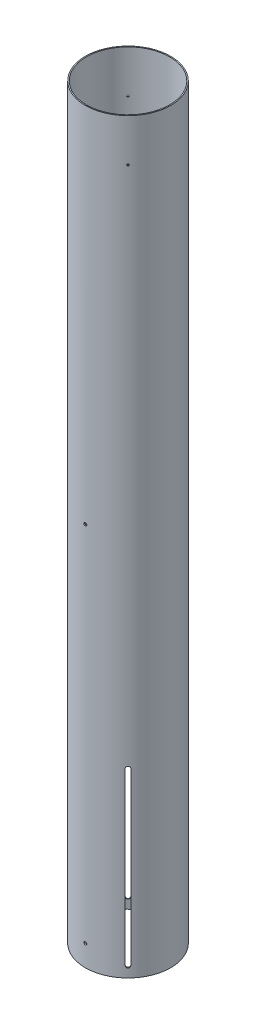
from build123d import *

# Parameters (mm, degrees)
SKETCH1_R           = 50.8
SKETCH1_R_2         = 49.53
BOSS_EXTRUDE1_DEPTH = 889
CUT_EXTRUDE1_DEPTH  = 152.4
CIRPATTERN1_COUNT   = 4
SKETCH3_R           = 1.7653
CUT_EXTRUDE2_DEPTH  = 11.684
SKETCH4_R           = 1.0922
CUT_EXTRUDE3_DEPTH  = 25.4
CIRPATTERN2_COUNT   = 2


with BuildPart() as part:
    # Sketch1 → Boss-Extrude1 (new body)
    with BuildSketch(Plane(origin=(0, 0, 0), x_dir=(1, 0, 0), z_dir=(0, 1, 0))):
        Circle(SKETCH1_R)
        Circle(SKETCH1_R_2, mode=Mode.SUBTRACT)
    extrude(amount=BOSS_EXTRUDE1_DEPTH)

    # Sketch2 → Cut-Extrude1 (cut)
    with BuildSketch(Plane(origin=(14.492117094, 1243.355570529, -192.628510082), x_dir=(0, 1, 0), z_dir=(0.7071067811865634, 0, -0.7071067811865316))):
        with BuildLine():
            Line((-1230.655570529, 128.342701458), (-1027.455570529, 128.342701458))
            ThreePointArc((-1027.455570529, 128.342701458), (-1025.074320529, 125.961451458), (-1027.455570529, 123.580201458))
            Line((-1027.455570529, 123.580201458), (-1230.655570529, 123.580201458))
            ThreePointArc((-1230.655570529, 123.580201458), (-1233.036820529, 125.961451458), (-1230.655570529, 128.342701458))
        make_face()
    cut_extrude1 = extrude(amount=-CUT_EXTRUDE1_DEPTH, mode=Mode.SUBTRACT)

    # CirPattern1: Cut-Extrude1 ×4 about axis
    cirpattern1_axis = Axis((0, 889, 0), (0, -1, 0))
    for i in range(1, CIRPATTERN1_COUNT):
        add(cut_extrude1.rotate(cirpattern1_axis, i * 360 / CIRPATTERN1_COUNT), mode=Mode.SUBTRACT)

    # Sketch3 → Cut-Extrude2 (cut)
    with BuildSketch(Plane(origin=(271.091614788, 1243.355570529, 52.3875), x_dir=(-1, 0, 0), z_dir=(0, 0, 1))):
        with Locations((271.091614788, 1217.955570529)):
            Circle(SKETCH3_R)
        with Locations((271.091614788, 786.155570529)):
            Circle(SKETCH3_R)
    extrude(amount=-CUT_EXTRUDE2_DEPTH, mode=Mode.SUBTRACT)

    # Sketch4 → Cut-Extrude3 (cut)
    with BuildSketch(Plane(origin=(120.58027232, 708.404628356, -48.738223352), x_dir=(-0.7071067811865634, 2.660214291711019e-15, 0.7071067811865317), z_dir=(0.7071067811865317, -1.2152886494782433e-14, 0.7071067811865634))):
        with Locations((119.72625647, -129.795371644)):
            Circle(SKETCH4_R)
    cut_extrude3 = extrude(amount=-CUT_EXTRUDE3_DEPTH, mode=Mode.SUBTRACT)

    # CirPattern2: Cut-Extrude3 ×2 about axis
    cirpattern2_axis = Axis((0, 889, 0), (0, -1, 0))
    for i in range(1, CIRPATTERN2_COUNT):
        add(cut_extrude3.rotate(cirpattern2_axis, i * 360 / CIRPATTERN2_COUNT), mode=Mode.SUBTRACT)


solid = part.part
